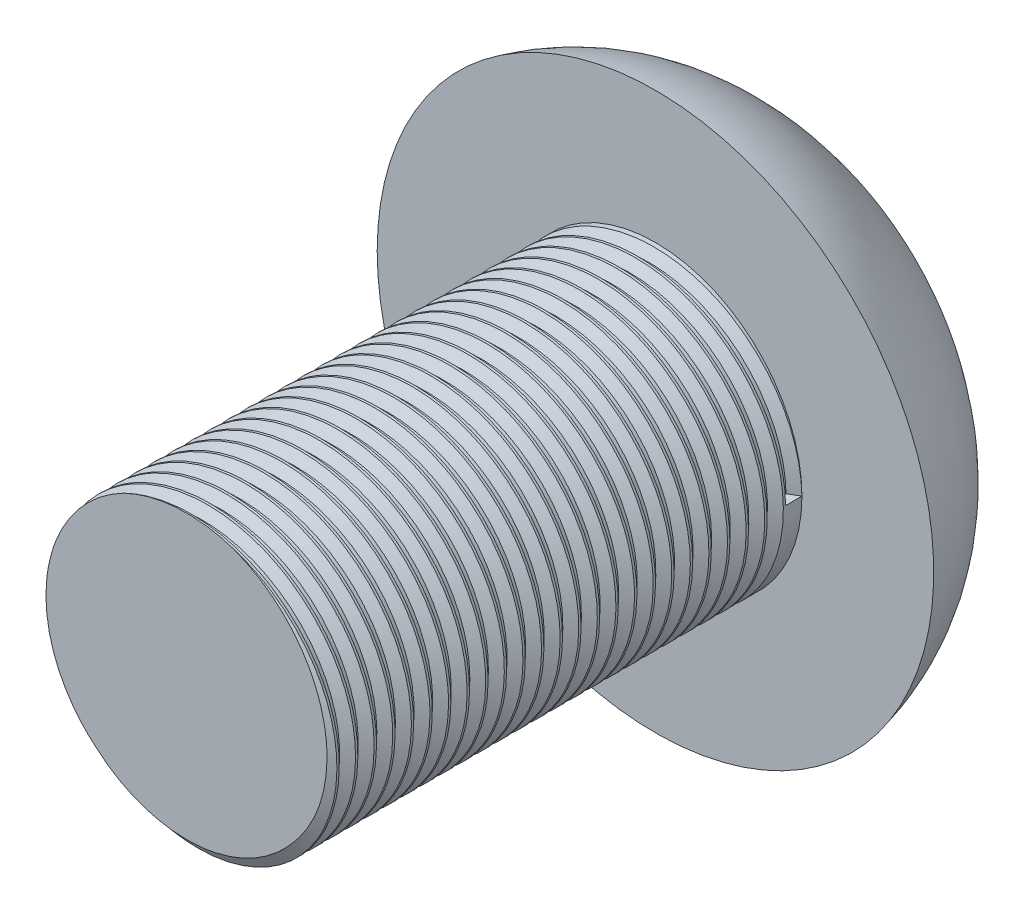
from build123d import *

# Parameters (mm, degrees)
SKETCH_1_R              = 4.75
SKETCH_1_R_2            = 1.732050808
EXTRUDE_2_DEPTH         = 2.7
CUT_REVOLVE_3_OUTLINE_W = 0.232050808
CUT_REVOLVE_3_OUTLINE_H = 2.7
SKETCH_4_R              = 2.5
EXTRUDE_3_DEPTH         = 8
THREAD_1_PITCH          = 0.3175
EXTRUDE_4_DEPTH         = 2.7


# Read off the part's stored shape, not the designer's step: 切除-旋转3
with BuildPart() as part:
    # Sketch 1 → 凸台-拉伸2 (new body)
    # profile 1 of 7: a face of its own
    with BuildSketch(Plane.XY):
        with Locations(Location((0, 0, 0), (0, 0, 180))):
            Circle(SKETCH_1_R)
        Circle(SKETCH_1_R_2, mode=Mode.SUBTRACT)
    # profile 2 of 7: a face of its own
    with BuildSketch(Plane.XY):
        with BuildLine():
            ThreePointArc((1.5, 0.866025404), (0.866025404, 1.5), (0, 1.732050808))
            Line((0, 1.732050808), (1.5, 0.866025404))
        make_face()
    # profile 3 of 7: a face of its own
    with BuildSketch(Plane.XY):
        with BuildLine():
            Line((1.5, 0.866025404), (1.5, -0.866025404))
            ThreePointArc((1.5, -0.866025404), (1.673032607, -0.448287736), (1.732050808, 0))
            ThreePointArc((1.732050808, 0), (1.673032607, 0.448287736), (1.5, 0.866025404))
        make_face()
    # profile 4 of 7: a face of its own
    with BuildSketch(Plane.XY):
        with BuildLine():
            Line((1.5, -0.866025404), (0, -1.732050808))
            ThreePointArc((0, -1.732050808), (0.866025404, -1.5), (1.5, -0.866025404))
        make_face()
    # profile 5 of 7: a face of its own
    with BuildSketch(Plane.XY):
        with BuildLine():
            Line((0, -1.732050808), (-1.5, -0.866025404))
            ThreePointArc((-1.5, -0.866025404), (-0.866025404, -1.5), (0, -1.732050808))
        make_face()
    # profile 6 of 7: a face of its own
    with BuildSketch(Plane.XY):
        with BuildLine():
            ThreePointArc((-1.5, 0.866025404), (-1.732050808, 0), (-1.5, -0.866025404))
            Line((-1.5, -0.866025404), (-1.5, 0.866025404))
        make_face()
    # profile 7 of 7: a face of its own
    with BuildSketch(Plane.XY):
        with BuildLine():
            ThreePointArc((0, 1.732050808), (-0.866025404, 1.5), (-1.5, 0.866025404))
            Line((-1.5, 0.866025404), (0, 1.732050808))
        make_face()
    extrude(amount=EXTRUDE_2_DEPTH)

    # 切除-旋转3 outline → 切除-旋转3 (revolve, cut)
    with BuildSketch(Plane.XZ):
        with Locations((1.616025404, 1.35)):
            Rectangle(CUT_REVOLVE_3_OUTLINE_W, CUT_REVOLVE_3_OUTLINE_H)
        with BuildLine():
            ThreePointArc((4.75, 2.7), (3.671145985, 0.869228867), (1.732050808, 0))
            Line((1.732050808, 0), (4.75, 0))
            Line((4.75, 0), (4.75, 2.7))
        make_face()
    revolve(axis=Axis((0, 0, 0), (0, 0, 1)), mode=Mode.SUBTRACT)

    # 草图4 → 凸台-拉伸3 (add)
    with BuildSketch(Plane.XY.offset(2.7)):
        Circle(SKETCH_4_R)
    extrude(amount=EXTRUDE_3_DEPTH)

    # 螺纹线1: the profile of Sketch 1 2 profile screwed along a right-hand helix of 62.992126 turns, 6 arcs to a turn; built about Z, then put on its axis
    thread_1_z = Axis((0, 0, 0), (0, 0, 1))
    thread_1_corners = [(2.5003, 0, -0.000173205), (2.5003, 0, 0.277985704), (2.328148085, 0, 0.17859375), (2.328148085, 0, 0.09921875)]
    with BuildLine(mode=Mode.PRIVATE) as thread_1_profile:
        Line(thread_1_corners[0], thread_1_corners[1])
        Line(thread_1_corners[1], thread_1_corners[2])
        Line(thread_1_corners[2], thread_1_corners[3])
        Line(thread_1_corners[3], thread_1_corners[0])
    thread_1_cap = Face(thread_1_profile.wire())
    thread_1_turn_angles = [0, 30, 60, 90, 120, 150, 180, 210, 240, 270, 300, 330, 360]
    thread_1_turn_weights = [1, 0.8660254037844387, 1, 0.8660254037844387, 1, 0.8660254037844387, 1, 0.8660254037844387, 1, 0.8660254037844387, 1, 0.8660254037844387, 1]
    thread_1_turn_rails = [Edge.make_bspline([Vector(p[0], p[1], 0).rotate(thread_1_z, thread_1_turn_angles[k]) / thread_1_turn_weights[k] + Vector(0, 0, p[2] + THREAD_1_PITCH * thread_1_turn_angles[k] / 360) for k in range(13)], [0, 0, 0, 1, 1, 2, 2, 3, 3, 4, 4, 5, 5, 6, 6, 6], 2, thread_1_turn_weights) for p in thread_1_corners]
    thread_1_turn_sides = [Face.make_surface_from_curves(thread_1_turn_rails[p[0]], thread_1_turn_rails[p[1]]) for p in [(0, 1), (1, 2), (2, 3), (3, 0)]]
    thread_1_turn = Solid(Shell([*thread_1_turn_sides, thread_1_cap, thread_1_cap.rotate(thread_1_z, 360).moved(Location((0, 0, THREAD_1_PITCH * 360 / 360)))]))
    thread_1_last_angles = [22320, 22350, 22380, 22410, 22440, 22470, 22500, 22530, 22560, 22590, 22620, 22648.582677165, 22677.165354331]
    thread_1_last_weights = [1, 0.8660254037844387, 1, 0.8660254037844387, 1, 0.8660254037844387, 1, 0.8660254037844387, 1, 0.8660254037844387, 1, 0.8781276632335074, 1]
    thread_1_last_rails = [Edge.make_bspline([Vector(p[0], p[1], 0).rotate(thread_1_z, thread_1_last_angles[k]) / thread_1_last_weights[k] + Vector(0, 0, p[2] + THREAD_1_PITCH * thread_1_last_angles[k] / 360) for k in range(13)], [0, 0, 0, 1, 1, 2, 2, 3, 3, 4, 4, 5, 5, 6, 6, 6], 2, thread_1_last_weights) for p in thread_1_corners]
    thread_1_last_sides = [Face.make_surface_from_curves(thread_1_last_rails[p[0]], thread_1_last_rails[p[1]]) for p in [(0, 1), (1, 2), (2, 3), (3, 0)]]
    thread_1_last = Solid(Shell([*thread_1_last_sides, thread_1_cap.rotate(thread_1_z, 22320).moved(Location((0, 0, THREAD_1_PITCH * 22320 / 360))), thread_1_cap.rotate(thread_1_z, 22677.165354331).moved(Location((0, 0, THREAD_1_PITCH * 22677.165354331 / 360)))]))
    thread_1_each = [*[thread_1_turn.moved(Location((0, 0, THREAD_1_PITCH * i))) for i in range(62)], thread_1_last]
    add(Plane(origin=(0, 0, 2.7), x_dir=(1, 0, 0), z_dir=(0, 0, 1)) * Compound([thread_1_each[i] for i in range(0, 63, 2)]), mode=Mode.SUBTRACT)
    add(Plane(origin=(0, 0, 2.7), x_dir=(1, 0, 0), z_dir=(0, 0, 1)) * Compound([thread_1_each[i] for i in range(1, 63, 2)]), mode=Mode.SUBTRACT)

    # 草图7 → 凸台-拉伸4 (add)
    with BuildSketch(Plane(origin=(0, 0, 2.7), x_dir=(-1, 0, 0), z_dir=(0, 0, -1))):
        with BuildLine():
            Line((-1.5, -0.866025404), (-1.5, 0.866025404))
            ThreePointArc((-1.5, 0.866025404), (-1.732050808, 0), (-1.5, -0.866025404))
        make_face()
        with BuildLine():
            ThreePointArc((0, 1.732050808), (-0.866025404, 1.5), (-1.5, 0.866025404))
            Line((-1.5, 0.866025404), (0, 1.732050808))
        make_face()
        with BuildLine():
            ThreePointArc((1.5, 0.866025404), (0.866025404, 1.5), (0, 1.732050808))
            Line((0, 1.732050808), (1.5, 0.866025404))
        make_face()
        with BuildLine():
            Line((0, -1.732050808), (-1.5, -0.866025404))
            ThreePointArc((-1.5, -0.866025404), (-0.866025404, -1.5), (0, -1.732050808))
        make_face()
        with BuildLine():
            Line((1.5, -0.866025404), (0, -1.732050808))
            ThreePointArc((0, -1.732050808), (0.866025404, -1.5), (1.5, -0.866025404))
        make_face()
        with BuildLine():
            ThreePointArc((1.732050808, 0), (1.673032607, 0.448287736), (1.5, 0.866025404))
            Line((1.5, 0.866025404), (1.5, -0.866025404))
            ThreePointArc((1.5, -0.866025404), (1.673032607, -0.448287736), (1.732050808, 0))
        make_face()
    extrude(amount=EXTRUDE_4_DEPTH)


solid = part.part
